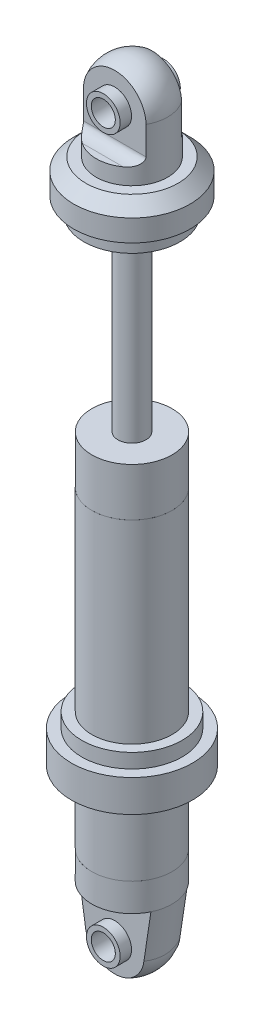
from build123d import *

# Parameters (mm, degrees)
SKETCH1_R                 = 5
BOSS_EXTRUDE1_DEPTH       = 6
SKETCH2_R                 = 5
BOSS_EXTRUDE2_DEPTH       = 39
SKETCH3_R                 = 5
BOSS_EXTRUDE3_DEPTH       = 3.5
BOSS_EXTRUDE4_DEPTH       = 2.15
BOSS_EXTRUDE4_DEPTH_BACK  = 2.5
SKETCH4_R                 = 1.5
SKETCH7_R                 = 1.75
BOSS_EXTRUDE5_DEPTH       = 23.5
SKETCH8_R                 = 6
BOSS_EXTRUDE6_DEPTH       = 2
SKETCH9_R                 = 7.25
BOSS_EXTRUDE7_DEPTH       = 4.2
SKETCH10_R                = 4.45
BOSS_EXTRUDE8_DEPTH       = 2
BOSS_EXTRUDE9_START       = -2.5
BOSS_EXTRUDE9_OUTLINE_R   = 1.5
BOSS_EXTRUDE9_DEPTH       = 4.65
CHAMFER1_SIZE             = 1.5
SKETCH14_R                = 7.55
SKETCH14_R_2              = 5
BOSS_EXTRUDE10_DEPTH      = 4
SKETCH15_R                = 6.25
SKETCH15_R_2              = 5
BOSS_EXTRUDE11_DEPTH      = 1.8
FILLET1_SIZE              = 1.5
FILLET1_SIZE_2            = 1
BOSS_EXTRUDE12_DEPTH      = 1.425
BOSS_EXTRUDE12_DEPTH_BACK = 6.075
SKETCH16_R                = 2.1
SKETCH16_R_2              = 1.5


# Read off the part's stored shape, not the designer's step: Boss-Extrude9
with BuildPart() as part:
    # Sketch1 → Boss-Extrude1 (new body)
    with BuildSketch(Plane(origin=(0, 0, 0), x_dir=(1, 0, 0), z_dir=(0, 1, 0))):
        with Locations(Location((0, 0, 0), (0, 0, 270))):
            Circle(SKETCH1_R)
    extrude(amount=BOSS_EXTRUDE1_DEPTH)

    # Sketch7 → Boss-Extrude5 (add)
    with BuildSketch(Plane(origin=(0, 6, 0), x_dir=(1, 0, 0), z_dir=(0, 1, 0))):
        with Locations(Location((0, 0, 0), (0, 0, 270))):
            Circle(SKETCH7_R)
    extrude(amount=BOSS_EXTRUDE5_DEPTH)

    # Sketch8 → Boss-Extrude6 (add)
    with BuildSketch(Plane(origin=(0, 29.5, 0), x_dir=(1, 0, 0), z_dir=(0, 1, 0))):
        with Locations(Location((0, 0, 0), (0, 0, 270))):
            Circle(SKETCH8_R)
    extrude(amount=BOSS_EXTRUDE6_DEPTH)

    # Sketch9 → Boss-Extrude7 (add)
    with BuildSketch(Plane(origin=(0, 31.5, 0), x_dir=(1, 0, 0), z_dir=(0, 1, 0))):
        with Locations(Location((0, 0, 0), (0, 0, 270))):
            Circle(SKETCH9_R)
    extrude(amount=BOSS_EXTRUDE7_DEPTH)

    # Sketch10 → Boss-Extrude8 (add)
    with BuildSketch(Plane(origin=(0, 35.7, 0), x_dir=(1, 0, 0), z_dir=(0, 1, 0))):
        with Locations(Location((0, 0, 0), (0, 0, 270))):
            Circle(SKETCH10_R)
    extrude(amount=BOSS_EXTRUDE8_DEPTH)

    # Boss-Extrude9 outline → Boss-Extrude9 (add)
    with BuildSketch(Plane.XY.offset(BOSS_EXTRUDE9_START)):
        with BuildLine():
            Line((-4.45, 37.7), (4.45, 37.7))
            Line((4.45, 37.7), (4.45, 42.2))
            ThreePointArc((4.45, 42.2), (0, 46.65), (-4.45, 42.2))
            Line((-4.45, 42.2), (-4.45, 37.7))
        make_face()
        with Locations((0, 42.2)):
            Circle(BOSS_EXTRUDE9_OUTLINE_R, mode=Mode.SUBTRACT)
    extrude(amount=BOSS_EXTRUDE9_DEPTH)

    # Cut-Sweep2: sweep along a path in Sketch13
    with BuildLine(Plane.XY.offset(2.15)) as cut_sweep2_path:
        Line((4.45, 37.7), (4.45, 42.2))
        ThreePointArc((4.45, 42.2), (0, 46.65), (-4.45, 42.2))
        Line((-4.45, 42.2), (-4.45, 37.7))
    # Sketch12 → Cut-Sweep2 (sweep, cut)
    with BuildSketch(Plane(origin=(0, 37.7, 0), x_dir=(1, 0, 0), z_dir=(0, 1, 0))):
        with BuildLine():
            Line((3.681372027, 2.5), (12.756673054, 2.5))
            Line((12.756673054, 2.5), (12.756673054, -2.15))
            Line((12.756673054, -2.15), (3.896151948, -2.15))
            ThreePointArc((3.896151948, -2.15), (4.445260667, 0.205323169), (3.681372027, 2.5))
        make_face()
    sweep(path=cut_sweep2_path.line, mode=Mode.SUBTRACT)

    # Chamfer1
    chamfer1_edges = [part.edges().sort_by_distance(p)[0] for p in [
        (0, 35.7, -7.25),
    ]]
    chamfer(chamfer1_edges, length=CHAMFER1_SIZE)

    # Fillet1
    # an asymmetric fillet: 1.5, 1 mm, written as the material it adds along each edge
    with BuildSketch(Plane(origin=(-7.646151948, 37.7, 2.15), x_dir=(0, 0, 1), z_dir=(1, 0, 0))) as fillet1_piece_1_section:
        with BuildLine():
            Bezier((FILLET1_SIZE, 0), (0, 0), (0, -FILLET1_SIZE_2), weights=[1, 0.707106781, 1])
            Line((0, -FILLET1_SIZE_2), (0, 0))
            Line((0, 0), (FILLET1_SIZE, 0))
        make_face()
    fillet1_piece_1 = extrude(amount=15.292303896, mode=Mode.PRIVATE)
    fillet1_piece_1 = fillet1_piece_1 & Plane(origin=(0, 37.925469926, 0), x_dir=(0, 0, 1), z_dir=(0, -1, 0)) * Cylinder(4.45, 37, mode=Mode.PRIVATE)
    add(fillet1_piece_1)
    with BuildSketch(Plane(origin=(-7.431372027, 37.7, -2.5), x_dir=(0, 0, -1), z_dir=(1, 0, 0))) as fillet1_piece_2_section:
        with BuildLine():
            Bezier((FILLET1_SIZE, 0), (0, 0), (0, FILLET1_SIZE_2), weights=[1, 0.707106781, 1])
            Line((0, FILLET1_SIZE_2), (0, 0))
            Line((0, 0), (FILLET1_SIZE, 0))
        make_face()
    fillet1_piece_2 = extrude(amount=14.862744054, mode=Mode.PRIVATE)
    fillet1_piece_2 = fillet1_piece_2 & Plane(origin=(0, 37.928455835, 0), x_dir=(0, 0, 1), z_dir=(0, -1, 0)) * Cylinder(4.45, 36, mode=Mode.PRIVATE)
    add(fillet1_piece_2)



with BuildPart() as body_2:
    # Sketch2 → Boss-Extrude2 (new body)
    with BuildSketch(Plane.XZ):
        with Locations(Location((0, 0, 0), (0, 0, 270))):
            Circle(SKETCH2_R)
    extrude(amount=BOSS_EXTRUDE2_DEPTH)


with BuildPart() as body_3:
    # Sketch3 → Boss-Extrude3 (new body)
    with BuildSketch(Plane.XZ.offset(39)):
        with Locations(Location((0, 0, 0), (0, 0, 270))):
            Circle(SKETCH3_R)
    extrude(amount=BOSS_EXTRUDE3_DEPTH)

    # Sketch4 → Boss-Extrude4 (add, two sides: drawn at the far end of the back side and taken through both)
    with BuildSketch(Plane.XY.offset(-BOSS_EXTRUDE4_DEPTH_BACK)):
        with BuildLine():
            Line((5, -42.5), (-5, -42.5))
            Line((-5, -42.5), (-4.10320992, -48.421424453))
            ThreePointArc((-4.10320992, -48.421424453), (1.7e-08, -51.95), (4.103209925, -48.421424419))
            Line((4.103209925, -48.421424419), (5, -42.5))
        make_face()
        with Locations((0, -47.8)):
            Circle(SKETCH4_R, mode=Mode.SUBTRACT)
    extrude(amount=BOSS_EXTRUDE4_DEPTH + BOSS_EXTRUDE4_DEPTH_BACK)

    # Cut-Sweep1: sweep along a path in Sketch6
    with BuildLine(Plane(origin=(0, 0, -2.5), x_dir=(-1, 0, 0), z_dir=(0, 0, -1))) as cut_sweep1_path:
        Line((-5, -42.5), (-4.10320992, -48.421424453))
        ThreePointArc((-4.10320992, -48.421424453), (0, -51.95), (4.10320992, -48.421424453))
        Line((4.10320992, -48.421424453), (5, -42.5))
    # Sketch5 → Cut-Sweep1 (sweep, cut)
    with BuildSketch(Plane.XZ.offset(42.5)):
        with BuildLine():
            Line((-4.514144437, 2.15), (-14.845117042, 2.15))
            ThreePointArc((-14.845117042, 2.15), (-14.998953997, -0.177141145), (-14.790199458, -2.5))
            Line((-14.790199458, -2.5), (-4.330127019, -2.5))
            ThreePointArc((-4.330127019, -2.5), (-4.99608941, -0.197713435), (-4.514144437, 2.15))
        make_face()
    sweep(path=cut_sweep1_path.line, mode=Mode.SUBTRACT)


with BuildPart() as body_4:
    # Sketch14 → Boss-Extrude10 (new body)
    with BuildSketch(Plane(origin=(0, -30, 0), x_dir=(1, 0, 0), z_dir=(0, 1, 0))):
        with Locations(Location((0, 0, 0), (0, 0, 270))):
            Circle(SKETCH14_R)
        with Locations(Location((0, 0, 0), (0, 0, 205.467560142))):
            Circle(SKETCH14_R_2, mode=Mode.SUBTRACT)
    extrude(amount=BOSS_EXTRUDE10_DEPTH)


with BuildPart() as body_5:
    # Sketch15 → Boss-Extrude11 (new body)
    with BuildSketch(Plane(origin=(0, -26, 0), x_dir=(1, 0, 0), z_dir=(0, 1, 0))):
        with Locations(Location((0, 0, 0), (0, 0, 270))):
            Circle(SKETCH15_R)
        with Locations(Location((0, 0, 0), (0, 0, 205.467560142))):
            Circle(SKETCH15_R_2, mode=Mode.SUBTRACT)
    extrude(amount=BOSS_EXTRUDE11_DEPTH)

    # Combine1: union body 4
    add(body_4.part)


with BuildPart() as part_1:
    add(part.part)

    add(body_3.part)  # Boss-Extrude12 merges body 3
    # Sketch16 → Boss-Extrude12 (add, two sides: drawn at the far end of the back side and taken through both)
    # profile 1 of 2: a face of its own
    with BuildSketch(Plane(origin=(0, 0, -2.5), x_dir=(-1, 0, 0), z_dir=(0, 0, -1)).offset(-BOSS_EXTRUDE12_DEPTH_BACK)):
        with Locations((0, 42.2)):
            Circle(SKETCH16_R)
        with Locations((0, 42.2)):
            Circle(SKETCH16_R_2, mode=Mode.SUBTRACT)
    # profile 2 of 2: a face of its own
    with BuildSketch(Plane(origin=(0, 0, -2.5), x_dir=(-1, 0, 0), z_dir=(0, 0, -1)).offset(-BOSS_EXTRUDE12_DEPTH_BACK)):
        with Locations((0, -47.8)):
            Circle(SKETCH16_R)
        with Locations((0, -47.8)):
            Circle(SKETCH16_R_2, mode=Mode.SUBTRACT)
    extrude(amount=BOSS_EXTRUDE12_DEPTH + BOSS_EXTRUDE12_DEPTH_BACK)


solid = Compound([body_2.part, body_5.part, part_1.part])
